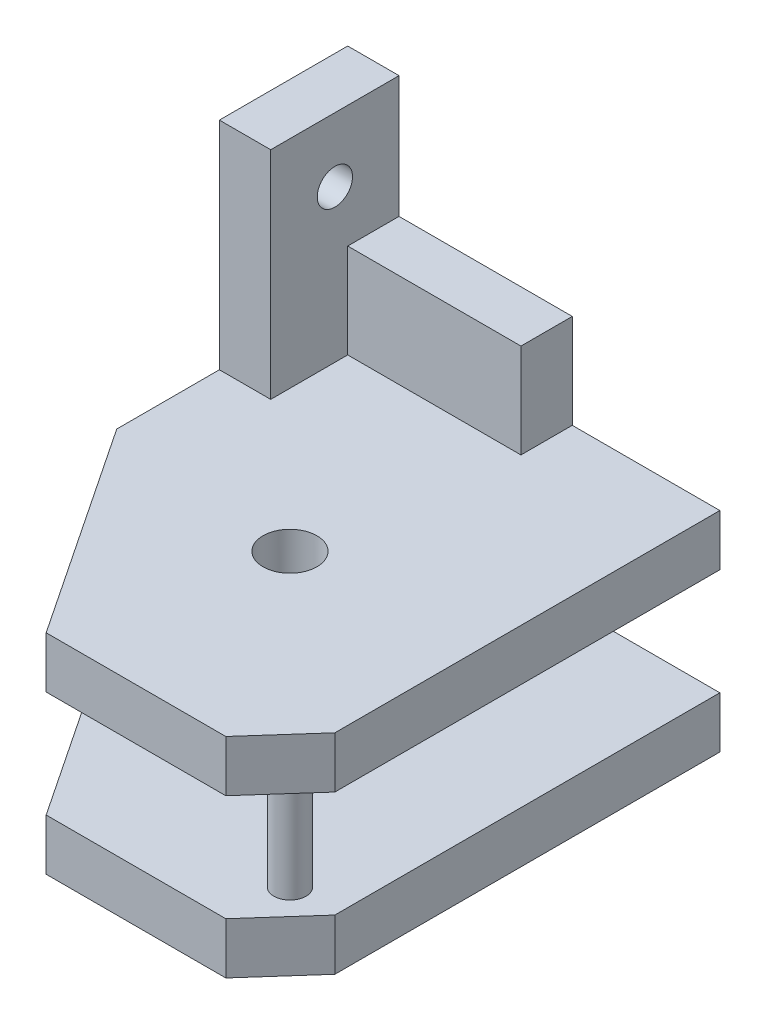
from build123d import *

# Parameters (mm, degrees)
SKETCH_1_W          = 8
SKETCH_1_H          = 100
EXTRUDE_2_DEPTH     = 20
SKETCH_2_W          = 27
SKETCH_2_H          = 14.7
EXTRUDE_4_DEPTH     = 8
EXTRUDE_6_DEPTH     = 16.3
CUT_EXTRUDE_1_DEPTH = 8.3
SKETCH_6_R          = 5.5
EXTRUDE_7_DEPTH     = 8.3
SKETCH_7_R          = 5.5
CUT_EXTRUDE_2_DEPTH = 7.5
SKETCH_8_R          = 2.5
EXTRUDE_8_DEPTH     = 8.3
SKETCH_9_R          = 4.2
CUT_EXTRUDE_3_DEPTH = 21.3
SKETCH_11_R         = 2.75
CUT_EXTRUDE_5_DEPTH = 13


with BuildPart() as part:
    # 草图1 → 凸台-拉伸2 (new body)
    with BuildSketch(Plane.XY):
        with Locations((4, 0)):
            Rectangle(SKETCH_1_W, SKETCH_1_H)
    extrude(amount=EXTRUDE_2_DEPTH)

    # 草图2 → 凸台-拉伸4 (add)
    with BuildSketch(Plane.XY):
        with Locations((21.5, -23.65)):
            Rectangle(SKETCH_2_W, SKETCH_2_H)
        with Locations((21.5, 23.65)):
            Rectangle(SKETCH_2_W, SKETCH_2_H)
    extrude(amount=EXTRUDE_4_DEPTH)

    # 草图4 → 凸台-拉伸6 (add, symmetric)
    with BuildSketch(Plane(origin=(0, 0, 0), x_dir=(1, 0, 0), z_dir=(0, 1, 0))):
        Polygon((0, 0), (58, 0), (58, -60), (50, -69), (22, -69), (0, -36), align=None)
    extrude(amount=EXTRUDE_6_DEPTH, both=True)

    # 草图5 → 切除-拉伸1 (cut, symmetric)
    with BuildSketch(Plane(origin=(0, 0, 0), x_dir=(1, 0, 0), z_dir=(0, 1, 0))):
        Polygon((8, 0), (58, 0), (58, -60), (50, -69), (22, -69), (0, -36), (0, -20), (8, -20), align=None)
    extrude(amount=CUT_EXTRUDE_1_DEPTH, both=True, mode=Mode.SUBTRACT)

    # 草图6 → 凸台-拉伸7 (add, symmetric)
    with BuildSketch(Plane(origin=(0, 0, 0), x_dir=(1, 0, 0), z_dir=(0, 1, 0))):
        with Locations((30, -39)):
            Circle(SKETCH_6_R)
    extrude(amount=EXTRUDE_7_DEPTH, both=True)

    # 草图7 → 切除-拉伸2 (cut, symmetric)
    with BuildSketch(Plane(origin=(0, 0, 0), x_dir=(1, 0, 0), z_dir=(0, 1, 0))):
        with Locations((30, -39)):
            Circle(SKETCH_7_R)
    extrude(amount=CUT_EXTRUDE_2_DEPTH, both=True, mode=Mode.SUBTRACT)

    # 草图8 → 凸台-拉伸8 (add, symmetric)
    with BuildSketch(Plane(origin=(0, 0, 0), x_dir=(1, 0, 0), z_dir=(0, 1, 0))):
        with Locations((50.718228689, -59.718228689)):
            Circle(SKETCH_8_R)
    extrude(amount=EXTRUDE_8_DEPTH, both=True)

    # 草图9 → 切除-拉伸3 (cut, symmetric)
    with BuildSketch(Plane(origin=(0, 0, 0), x_dir=(1, 0, 0), z_dir=(0, 1, 0))):
        with Locations((30, -39)):
            Circle(SKETCH_9_R)
    extrude(amount=CUT_EXTRUDE_3_DEPTH, both=True, mode=Mode.SUBTRACT)

    # 草图11 → 切除-拉伸5 (cut, symmetric)
    with BuildSketch(Plane(origin=(0, 0, 0), x_dir=(0, 0, -1), z_dir=(1, 0, 0))):
        with Locations((-10, -40)):
            Circle(SKETCH_11_R)
        with Locations((-10, 40)):
            Circle(SKETCH_11_R)
    extrude(amount=CUT_EXTRUDE_5_DEPTH, both=True, mode=Mode.SUBTRACT)


solid = part.part
